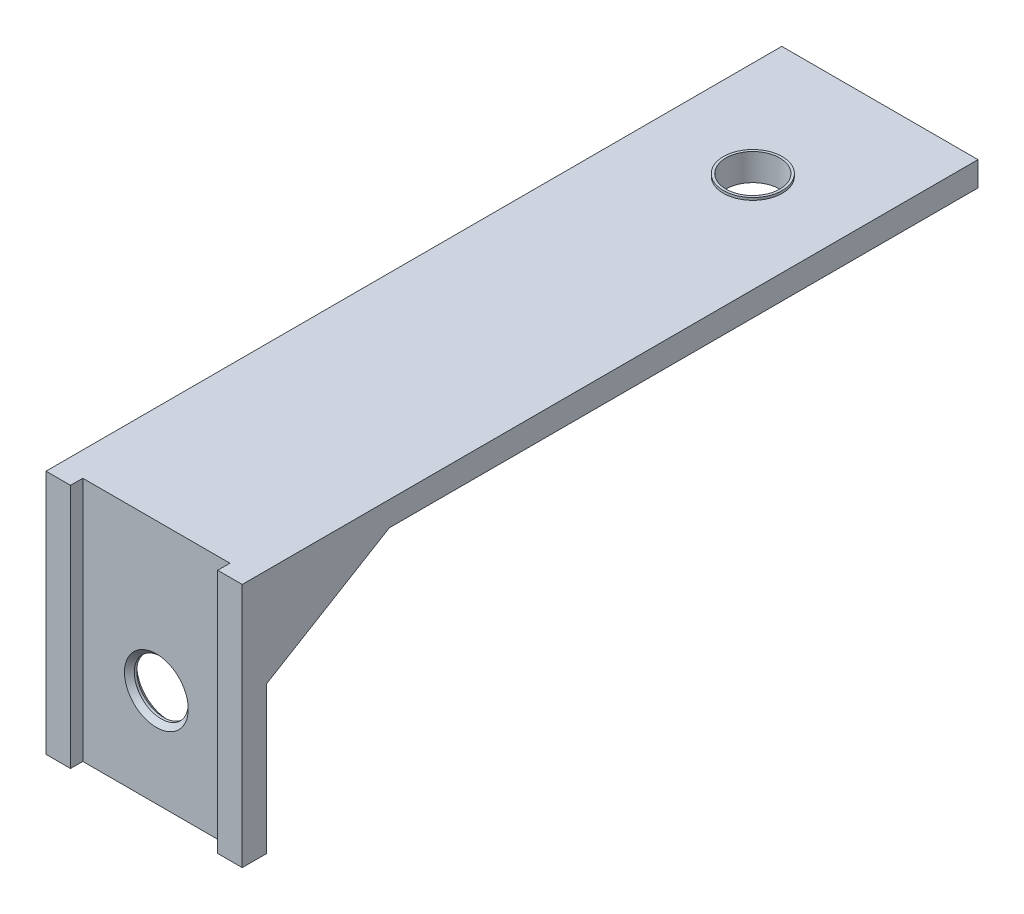
from build123d import *

# Parameters (mm, degrees)
DODANIE_WYCI_GNI_CIE1_DEPTH = 40
SZKIC2_W                    = 30
SZKIC2_H                    = 2.5
WYTNIJ_WYCI_GNI_CIE1_DEPTH  = 164.095064303
EBRO3_START                 = -5
EBRO3_DEPTH                 = 5
SZKIC4_R                    = 5.5
WYTNIJ_WYCI_GNI_CIE2_DEPTH  = 10
SFAZOWANIE1_SIZE            = 1
WYTNIJ_WYCI_GNI_CIE3_DEPTH  = 10
DODANIE_WYCI_GNI_CIE2_START = 0.5
SZKIC6_R                    = 6
SZKIC6_R_2                  = 5.5
DODANIE_WYCI_GNI_CIE2_DEPTH = 0.5


# Read off the part's stored shape, not the designer's step: Żebro3
with BuildPart() as part:
    # Szkic1 → Dodanie-wyciągnięcie1 (new body)
    with BuildSketch(Plane(origin=(0, 0, 0), x_dir=(0, 0, -1), z_dir=(1, 0, 0))):
        Polygon((0, 0), (0, 50), (150, 50), (150, 45), (5, 45), (5, 0), align=None)
    extrude(amount=DODANIE_WYCI_GNI_CIE1_DEPTH)

    # Szkic2 → Wytnij-wyciągnięcie1 (cut, through all)
    with BuildSketch(Plane(origin=(0, 50, 0), x_dir=(1, 0, 0), z_dir=(0, 1, 0))):
        with Locations((20, 1.25)):
            Rectangle(SZKIC2_W, SZKIC2_H)
    extrude(amount=-WYTNIJ_WYCI_GNI_CIE1_DEPTH, mode=Mode.SUBTRACT)

    # Żebro3 outline → Żebro3 (add)
    with BuildSketch(Plane(origin=(40, 0, 0), x_dir=(0, 0, -1), z_dir=(1, 0, 0)).offset(EBRO3_START)):
        Polygon((5, 30), (30, 45), (5, 45), align=None)
    ebro3 = extrude(amount=EBRO3_DEPTH)

    # Lustro1: Żebro3 across plane
    add(ebro3.mirror(Plane(origin=(20, 0, 0), x_dir=(0, 0, 1), z_dir=(1, 0, 0))))

    # Szkic4 → Wytnij-wyciągnięcie2 (cut)
    with BuildSketch(Plane(origin=(0, 0, -5), x_dir=(-1, 0, 0), z_dir=(0, 0, -1))):
        with Locations((-20, 20)):
            Circle(SZKIC4_R)
    extrude(amount=-WYTNIJ_WYCI_GNI_CIE2_DEPTH, mode=Mode.SUBTRACT)

    # Sfazowanie1
    sfazowanie1_edges = [part.edges().sort_by_distance(p)[0] for p in [
        (25.5, 20, -2.5),
        (25.5, 20, -5),
    ]]
    chamfer(sfazowanie1_edges, length=SFAZOWANIE1_SIZE)

    # Szkic5 → Wytnij-wyciągnięcie3 (cut)
    with BuildSketch(Plane(origin=(0, 50, 0), x_dir=(1, 0, 0), z_dir=(0, 1, 0))):
        with BuildLine():
            ThreePointArc((20, 129.597336258), (14.5, 124.097336258), (20, 118.597336258))
            Line((20, 118.597336258), (20, 129.597336258))
        make_face()
        with BuildLine():
            Line((20, 129.597336258), (20, 118.597336258))
            ThreePointArc((20, 118.597336258), (23.889087297, 120.208248962), (25.5, 124.097336258))
            ThreePointArc((25.5, 124.097336258), (23.889087297, 127.986423555), (20, 129.597336258))
        make_face()
    extrude(amount=-WYTNIJ_WYCI_GNI_CIE3_DEPTH, mode=Mode.SUBTRACT)

    # Szkic6 → Dodanie-wyciągnięcie2 (add)
    with BuildSketch(Plane(origin=(0, 50, 0), x_dir=(1, 0, 0), z_dir=(0, 1, 0)).offset(DODANIE_WYCI_GNI_CIE2_START)):
        with Locations(Location((20, 124.097336258, 0), (0, 0, 270))):
            Circle(SZKIC6_R)
        with Locations(Location((20, 124.097336258, 0), (0, 0, 270))):
            Circle(SZKIC6_R_2, mode=Mode.SUBTRACT)
    extrude(amount=-DODANIE_WYCI_GNI_CIE2_DEPTH)


solid = part.part
